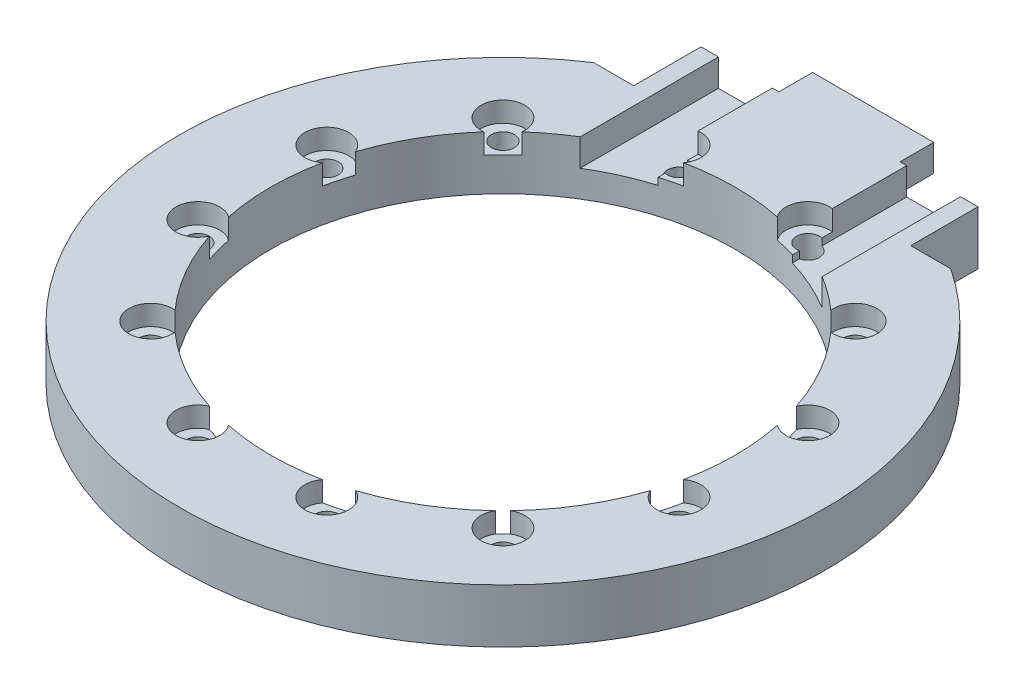
from build123d import *

# Parameters (mm, degrees)
SKETCH_1_R                   = 26.5
EXTRUDE_1_DEPTH              = 5
HOLE_WIZARD_M4_1_AT_2_COUNT  = 2
HOLE_WIZARD_M4_1_AT_2_PITCH  = 39.424388736
HOLE_WIZARD_M4_1_AT_3_COUNT  = 2
HOLE_WIZARD_M4_1_AT_3_PITCH  = 39.424388736
HOLE_WIZARD_M4_1_AT_4_COUNT  = 2
HOLE_WIZARD_M4_1_AT_4_PITCH  = 18.383894388
HOLE_WIZARD_M4_1_AT_5_COUNT  = 2
HOLE_WIZARD_M4_1_AT_5_PITCH  = 43.5
HOLE_WIZARD_M4_1_AT_6_COUNT  = 2
HOLE_WIZARD_M4_1_AT_6_PITCH  = 39.424388736
HOLE_WIZARD_M4_1_AT_7_COUNT  = 2
HOLE_WIZARD_M4_1_AT_7_PITCH  = 18.383894388
EXTRUDE_1550_DEPTH           = 8
CUT_EXTRUDE_1748_DEPTH       = 22
SKETCH_8_R                   = 34.5
CUT_EXTRUDE_1834_DEPTH       = 119.962346984
HOLE_WIZARD_M3_1_D           = 3.4
HOLE_WIZARD_M3_1_CBORE_D     = 6.5
HOLE_WIZARD_M3_1_CBORE_DEPTH = 3
CUT_EXTRUDE_1_DEPTH          = 15
CUT_EXTRUDE_2_DEPTH          = 5
CUT_EXTRUDE_3_DEPTH          = 10
CUT_EXTRUDE_START            = -10
SKETCH_14_R                  = 26.5
CUT_EXTRUDE_4_DEPTH          = 10


with BuildPart() as part:
    # 草图1 → 凸台-拉伸1 (new body)
    with BuildSketch(Plane.XY):
        Circle(SKETCH_1_R)
    extrude(amount=EXTRUDE_1_DEPTH)

    # 草图3 → M4 六角凹头盖的柱孔1 (revolve, cut)
    with BuildSketch(Plane(origin=(21.75, 0, 5), x_dir=(0, -1, 0), z_dir=(1, 0, 0))):
        Polygon((0, 0), (0, 5), (2.25, 5), (2.25, 4), (4, 4), (4, 0), align=None)
    hole_wizard_m4_1 = revolve(axis=Axis((21.75, 0, 11.35), (0, 0, -1)), mode=Mode.SUBTRACT)

    # M4 六角凹头盖的柱孔1 at 2: M4 六角凹头盖的柱孔1 ×2
    with Locations(*[Vector(-0.9063077870366496, 0.4226182617407002, 0) * (i * HOLE_WIZARD_M4_1_AT_2_PITCH) for i in range(1, HOLE_WIZARD_M4_1_AT_2_COUNT)]):
        add(hole_wizard_m4_1, mode=Mode.SUBTRACT)

    # M4 六角凹头盖的柱孔1 at 3: M4 六角凹头盖的柱孔1 ×2
    with Locations(*[Vector(-0.9063077870125524, 0.42261826179237694, 0) * (i * HOLE_WIZARD_M4_1_AT_3_PITCH) for i in range(1, HOLE_WIZARD_M4_1_AT_3_COUNT)]):
        add(hole_wizard_m4_1, mode=Mode.SUBTRACT)

    # M4 六角凹头盖的柱孔1 at 4: M4 六角凹头盖的柱孔1 ×2
    with Locations(*[Vector(-0.42261826172613215, 0.9063077870434428, 0) * (i * HOLE_WIZARD_M4_1_AT_4_PITCH) for i in range(1, HOLE_WIZARD_M4_1_AT_4_COUNT)]):
        add(hole_wizard_m4_1, mode=Mode.SUBTRACT)

    # M4 六角凹头盖的柱孔1 at 5: M4 六角凹头盖的柱孔1 ×2
    with Locations(*[(-i * HOLE_WIZARD_M4_1_AT_5_PITCH, 0, 0) for i in range(1, HOLE_WIZARD_M4_1_AT_5_COUNT)]):
        add(hole_wizard_m4_1, mode=Mode.SUBTRACT)

    # M4 六角凹头盖的柱孔1 at 6: M4 六角凹头盖的柱孔1 ×2
    with Locations(*[Vector(-0.9063077870125524, -0.42261826179237694, 0) * (i * HOLE_WIZARD_M4_1_AT_6_PITCH) for i in range(1, HOLE_WIZARD_M4_1_AT_6_COUNT)]):
        add(hole_wizard_m4_1, mode=Mode.SUBTRACT)

    # M4 六角凹头盖的柱孔1 at 7: M4 六角凹头盖的柱孔1 ×2
    with Locations(*[Vector(-0.42261826172613215, -0.9063077870434428, 0) * (i * HOLE_WIZARD_M4_1_AT_7_PITCH) for i in range(1, HOLE_WIZARD_M4_1_AT_7_COUNT)]):
        add(hole_wizard_m4_1, mode=Mode.SUBTRACT)

    # 草图5 → Extrude 1550 (add)
    with BuildSketch(Plane.XZ.offset(-8.7)):
        with BuildLine():
            Line((-26.5, 5), (-26.5, 14.978130978))
            ThreePointArc((-26.5, 14.978130978), (0, 103), (26.5, 14.978130978))
            Line((26.5, 14.978130978), (26.5, 5))
            Line((26.5, 5), (-26.5, 5))
        make_face()
    extrude(amount=-EXTRUDE_1550_DEPTH)

    # 草图6 → Cut-Extrude 1748 (cut)
    with BuildSketch(Plane.XY.offset(5)):
        Polygon((-17.98063051, 12.66146664), (-9.98063051, 12.66146664), (-9.980816117, 16.7), (-17.98063051, 16.7), align=None)
        Polygon((9.980816117, 16.7), (17.98063051, 16.7), (17.98063051, 12.66146664), (9.98063051, 12.66146664), align=None)
    extrude(amount=CUT_EXTRUDE_1748_DEPTH, mode=Mode.SUBTRACT)

    # 草图8 → Cut-Extrude 1834 (cut, through all)
    with BuildSketch(Plane.XZ.offset(-8.7)):
        with Locations((0, 55)):
            Circle(SKETCH_8_R)
    extrude(amount=-CUT_EXTRUDE_1834_DEPTH, mode=Mode.SUBTRACT)

    # M3 六角凹头盖的柱孔1 (through all)
    with Locations(Plane(origin=(-9.576304669, 16.7, 19.260744427), x_dir=(0, 0, 1), z_dir=(0, 1, 0))):
        with Locations((0, 0), (0, 19.152609338), (9.576304669, 35.739255573), (26.162950904, 45.315560242), (45.315560242, 45.315560242), (62.358629164, 36.19567826), (71.478511143, 19.152609339), (71.478511146, 0), (61.902206477, -16.586646235), (9.576304669, -16.586646235), (26.162950904, -26.162950904), (45.315560242, -26.162950904)):
            CounterBoreHole(HOLE_WIZARD_M3_1_D / 2, HOLE_WIZARD_M3_1_CBORE_D / 2, HOLE_WIZARD_M3_1_CBORE_DEPTH)

    # 草图11 → 切除-拉伸1 (cut)
    with BuildSketch(Plane.XY):
        Polygon((-25.031180555, 8.7), (-29.031180555, 8.7), (-29.031180555, 16.7), (-20.575713839, 16.7), (-20.575713839, 8.7), align=None)
        Polygon((20.575713839, 8.7), (25.031180555, 8.7), (29.031180555, 8.7), (29.031180555, 16.7), (20.575713839, 16.7), align=None)
    extrude(amount=CUT_EXTRUDE_1_DEPTH, mode=Mode.SUBTRACT)

    # 草图12 → 切除-拉伸2 (cut)
    with BuildSketch(Plane.XZ.offset(-8.7)):
        with BuildLine():
            Line((30.640436297, 73.992699353), (39.299497484, 79.033088453))
            ThreePointArc((39.299497484, 79.033088453), (22.961941343, 94.93481054), (1, 101.054748323))
            Line((1, 101.054748323), (1, 90.986108088))
            ThreePointArc((1, 90.986108088), (3.29678588, 90.848726312), (5.580104544, 90.56490417))
            ThreePointArc((5.580104544, 90.56490417), (10.611585442, 94.602959438), (12.949935188, 88.59015553))
            ThreePointArc((12.949935188, 88.59015553), (18.110429302, 86.112886725), (22.813026139, 82.848971404))
            ThreePointArc((22.813026139, 82.848971404), (29.429042421, 84.466469087), (27.899229179, 77.829629354))
            ThreePointArc((27.899229179, 77.829629354), (29.332637394, 75.956033707), (30.640436297, 73.992699353))
        make_face()
        with BuildLine():
            Line((31.628764833, 37.893824648), (40.299497484, 32.887774818))
            ThreePointArc((40.299497484, 32.887774818), (45.9673073, 55.081606369), (40.220731453, 77.255173811))
            Line((40.220731453, 77.255173811), (31.60381627, 72.239317654))
            ThreePointArc((31.60381627, 72.239317654), (32.667369713, 70.12740004), (33.58998558, 67.95021794))
            ThreePointArc((33.58998558, 67.95021794), (39.603491283, 65.610874453), (35.563251124, 60.5798469))
            ThreePointArc((35.563251124, 60.5798469), (35.998326415, 55.004146142), (35.564535509, 49.428345312))
            ThreePointArc((35.564535509, 49.428345312), (39.60579141, 44.366506044), (33.551263667, 42.065058704))
            ThreePointArc((33.551263667, 42.065058704), (32.656681203, 39.948715244), (31.628764833, 37.893824648))
        make_face()
        with BuildLine():
            Line((19.898823765, 25.001394455), (25.409425198, 16.693850218))
            ThreePointArc((25.409425198, 16.693850218), (33.152641178, 23.15816615), (39.299497484, 31.15572401))
            Line((39.299497484, 31.15572401), (30.628764833, 36.161773841))
            ThreePointArc((30.628764833, 36.161773841), (29.36313556, 34.244126853), (27.977619592, 32.411223983))
            ThreePointArc((27.977619592, 32.411223983), (29.011771602, 26.01712548), (22.607462255, 26.98603612))
            ThreePointArc((22.607462255, 26.98603612), (21.276296399, 25.962115548), (19.898823765, 25.001394455))
        make_face()
        with BuildLine():
            Line((-1, 90.986108088), (-1, 101.054748323))
            ThreePointArc((-1, 101.054748323), (-22.961941343, 94.93481054), (-39.299497484, 79.033088453))
            Line((-39.299497484, 79.033088453), (-30.640436297, 73.992699353))
            ThreePointArc((-30.640436297, 73.992699353), (-29.332637394, 75.956033707), (-27.899229179, 77.829629354))
            ThreePointArc((-27.899229179, 77.829629354), (-29.429042421, 84.466469087), (-22.813026139, 82.848971404))
            ThreePointArc((-22.813026139, 82.848971404), (-18.110429302, 86.112886725), (-12.949935188, 88.59015553))
            ThreePointArc((-12.949935188, 88.59015553), (-10.611585442, 94.602959438), (-5.580104544, 90.56490417))
            ThreePointArc((-5.580104544, 90.56490417), (-3.29678588, 90.848726312), (-1, 90.986108088))
        make_face()
        with BuildLine():
            ThreePointArc((-33.58998558, 67.95021794), (-32.667369713, 70.12740004), (-31.60381627, 72.239317654))
            Line((-31.60381627, 72.239317654), (-40.220731453, 77.255173811))
            ThreePointArc((-40.220731453, 77.255173811), (-45.9673073, 55.081606369), (-40.299497484, 32.887774818))
            Line((-40.299497484, 32.887774818), (-31.628764833, 37.893824648))
            ThreePointArc((-31.628764833, 37.893824648), (-32.656681203, 39.948715244), (-33.551263667, 42.065058704))
            ThreePointArc((-33.551263667, 42.065058704), (-39.60579141, 44.366506044), (-35.564535509, 49.428345312))
            ThreePointArc((-35.564535509, 49.428345312), (-35.998326415, 55.004146142), (-35.563251124, 60.5798469))
            ThreePointArc((-35.563251124, 60.5798469), (-39.603491283, 65.610874453), (-33.58998558, 67.95021794))
        make_face()
        with BuildLine():
            Line((-30.628764833, 36.161773841), (-39.299497484, 31.15572401))
            ThreePointArc((-39.299497484, 31.15572401), (-33.152641178, 23.15816615), (-25.409425198, 16.693850218))
            Line((-25.409425198, 16.693850218), (-19.898823765, 25.001394455))
            ThreePointArc((-19.898823765, 25.001394455), (-21.276296399, 25.962115548), (-22.607462255, 26.98603612))
            ThreePointArc((-22.607462255, 26.98603612), (-29.011771602, 26.01712548), (-27.977619592, 32.411223983))
            ThreePointArc((-27.977619592, 32.411223983), (-29.36313556, 34.244126853), (-30.628764833, 36.161773841))
        make_face()
    extrude(amount=-CUT_EXTRUDE_2_DEPTH, mode=Mode.SUBTRACT)

    # 草图13 → 切除-拉伸3 (cut)
    with BuildSketch(Plane.XY.offset(5)):
        with BuildLine():
            Line((-12.219247113, 8.7), (12.219247113, 8.7))
            ThreePointArc((12.219247113, 8.7), (0, -15), (-12.219247113, 8.7))
        make_face()
    extrude(amount=-CUT_EXTRUDE_3_DEPTH, mode=Mode.SUBTRACT)

    # 草图14 → 切除-拉伸4 (cut)
    with BuildSketch(Plane.XY.offset(5).offset(CUT_EXTRUDE_START)):
        Circle(SKETCH_14_R)
        Polygon((-9, 16.7), (9, 16.7), (9, 12.7), (0, 12.7), (-9, 12.7), align=None, mode=Mode.SUBTRACT)
    extrude(amount=CUT_EXTRUDE_4_DEPTH, mode=Mode.SUBTRACT)


solid = part.part
